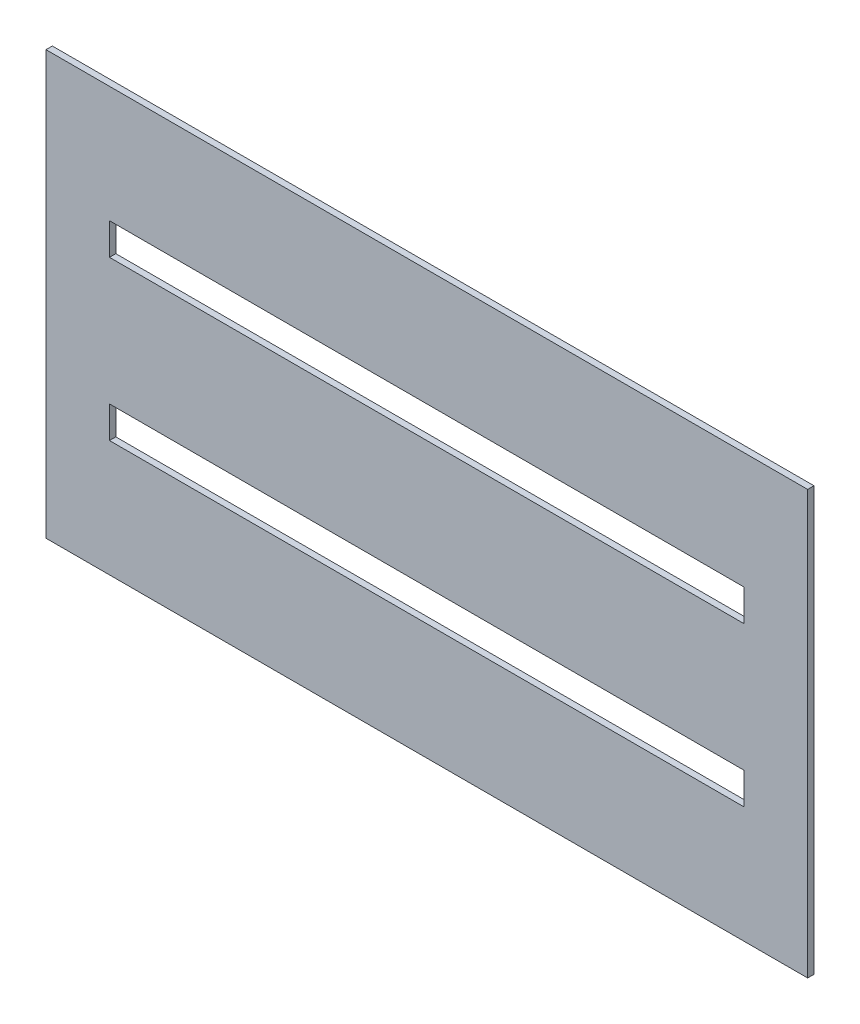
from build123d import *

# Parameters (mm, degrees)
CROQUIS1_W              = 360
CROQUIS1_H              = 200
SALIENTE_EXTRUIR1_DEPTH = 3
CROQUIS2_W              = 300
CROQUIS2_H              = 15
CORTAR_EXTRUIR1_DEPTH   = 10


with BuildPart() as part:
    # Croquis1 → Saliente-Extruir1 (new body)
    with BuildSketch(Plane.XY):
        Rectangle(CROQUIS1_W, CROQUIS1_H)
    extrude(amount=SALIENTE_EXTRUIR1_DEPTH)

    # Croquis2 → Cortar-Extruir1 (cut)
    with BuildSketch(Plane(origin=(0, 0, 0), x_dir=(-1, 0, 0), z_dir=(0, 0, -1))):
        with Locations((0, 37.5)):
            Rectangle(CROQUIS2_W, CROQUIS2_H)
        with Locations((0, -37.5)):
            Rectangle(CROQUIS2_W, CROQUIS2_H)
    extrude(amount=-CORTAR_EXTRUIR1_DEPTH, mode=Mode.SUBTRACT)


solid = part.part
